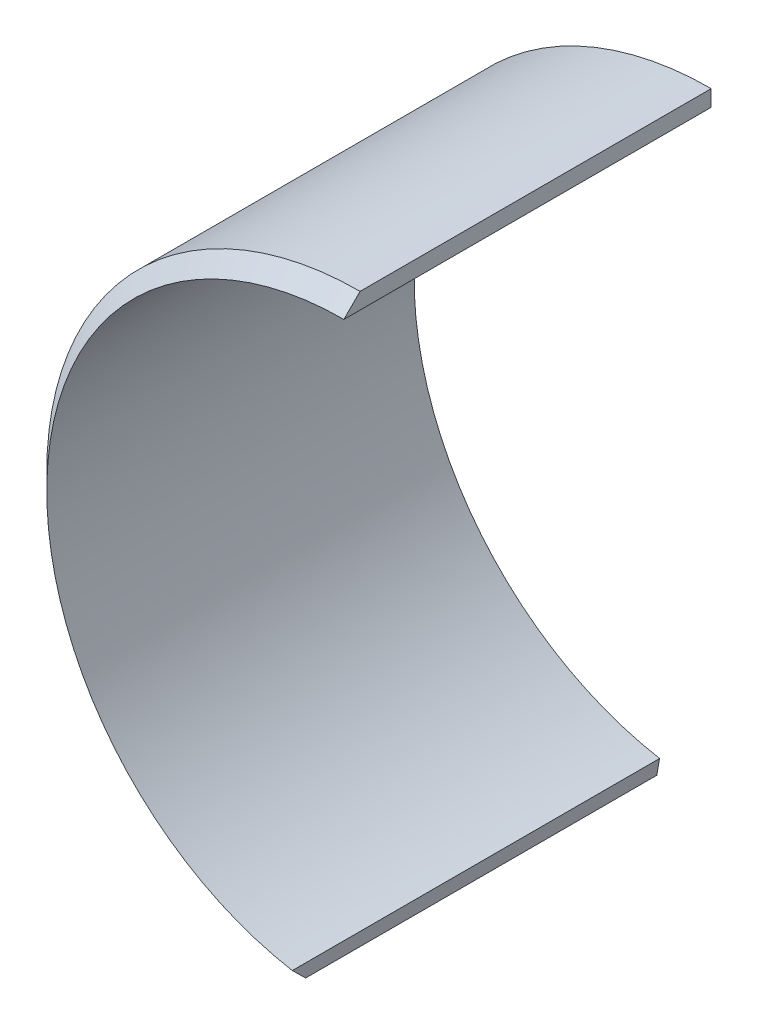
from build123d import *

# Parameters (mm, degrees)
BOSS_EXTRUDE1_DEPTH = 19.05
CHAMFER1_SIZE       = 2.54


with BuildPart() as part:
    # Sketch1 → Boss-Extrude1 (new body)
    with BuildSketch(Plane.XY):
        with BuildLine():
            Line((-2.558184953, -14.508187817), (-2.425865042, -13.75776431))
            ThreePointArc((-2.425865042, -13.75776431), (-13.916839932, 1.217565726), (0, 13.97))
            Line((0, 13.97), (0, 14.732))
            ThreePointArc((0, 14.732), (-14.675940292, 1.283978402), (-2.558184953, -14.508187817))
        make_face()
    extrude(amount=BOSS_EXTRUDE1_DEPTH)

    # Chamfer1
    # the kernel refuses this chamfer: 2.54 mm, written as the material it takes off along each edge
    with BuildSketch(Plane(origin=(0, 0, 19.05), x_dir=(0.42958176080466437, 0.9030279678858038, 0), z_dir=(0.9030279678858038, -0.42958176080466437, 0))) as chamfer1_piece_1:
        Polygon((14.732, -CHAMFER1_SIZE), (14.732 - CHAMFER1_SIZE, 0), (14.732, 0), align=None)
    revolve(axis=Axis((0, 0, 19.05), (0, 0, 1)), revolution_arc=220.882041127, mode=Mode.SUBTRACT)


solid = part.part
